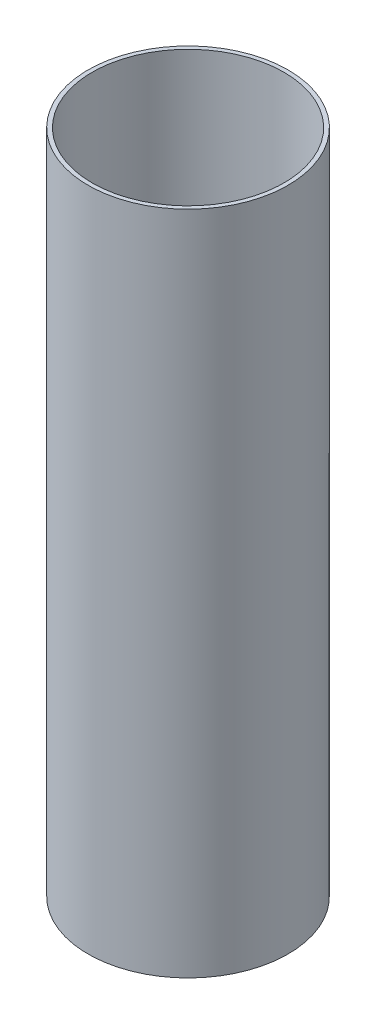
from build123d import *

# Parameters (mm, degrees)
SKETCH2_W = 1.143
SKETCH2_H = 187.325


with BuildPart() as part:
    # Sketch2 → Revolve1 (revolve)
    with BuildSketch(Plane.XY):
        with Locations((27.559, -104.958034739)):
            Rectangle(SKETCH2_W, SKETCH2_H)
    revolve(axis=Axis((0, 0, 0), (0, 1, 0)))


solid = part.part
